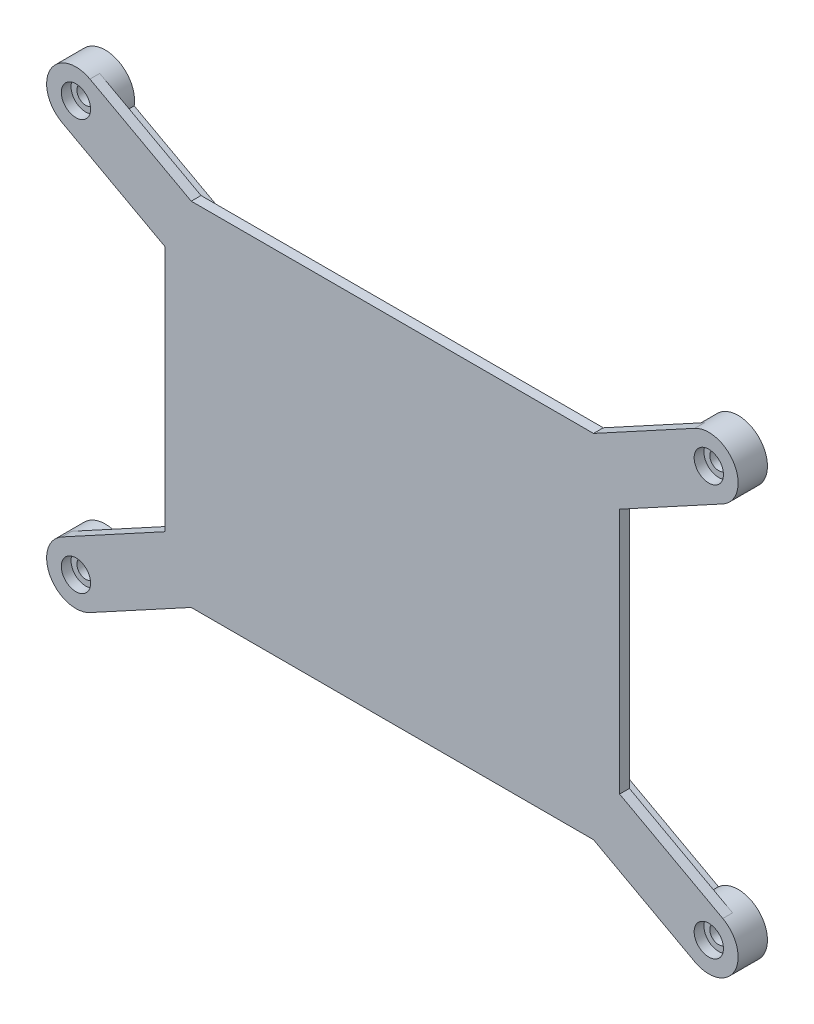
from build123d import *
from build123d.topology import SkipClean

# Parameters (mm, degrees)
BOSS_EXTRUDE4_DEPTH            = 4
BOSS_EXTRUDE4_2_DEPTH          = 4
BOSS_EXTRUDE7_START            = 4
SKETCH13_W                     = 77
SKETCH13_H                     = 2
BOSS_EXTRUDE7_DEPTH            = 2
CUT_EXTRUDE3_REACH             = 87.589
SKETCH11_W                     = 2
SKETCH11_H                     = 2.2
CUT_EXTRUDE3_DIRECTION_2_REACH = 87.589
BOSS_EXTRUDE6_DEPTH            = 2
M3_CLEARANCE_HOLE1_D           = 3.6
SKETCH16_R                     = 3
CUT_EXTRUDE4_DEPTH             = 2
CHAMFER2_SIZE                  = 2
CHAMFER3_SIZE                  = 0.5


with BuildPart() as part:
    # Sketch9 → Boss-Extrude4 (new body)
    with BuildSketch(Plane.XY):
        with BuildLine():
            Line((-60.736133913, -37.540305051), (-42.5, -27.622167018))
            Line((-42.5, -27.622167018), (-42.5, 27.622167018))
            Line((-42.5, 27.622167018), (-60.736133913, 37.540305051))
            ThreePointArc((-60.736133913, 37.540305051), (-70.020874221, 44.866685358), (-58.825010341, 41.054221199))
            Line((-58.825010341, 41.054221199), (-38.5, 30))
            Line((-38.5, 30), (-38.5, -30))
            Line((-38.5, -30), (-58.825010341, -41.054221199))
            ThreePointArc((-58.825010341, -41.054221199), (-70.020874221, -44.866685358), (-60.736133913, -37.540305051))
        make_face()
    extrude(amount=BOSS_EXTRUDE4_DEPTH)



with BuildPart() as body_2:
    # Sketch9 → Boss-Extrude4 2 (new body)
    with BuildSketch(Plane.XY):
        with BuildLine():
            Line((38.5, -30), (58.825010341, -41.054221199))
            ThreePointArc((58.825010341, -41.054221199), (70.020874221, -44.866685358), (60.736133913, -37.540305051))
            Line((60.736133913, -37.540305051), (42.5, -27.622167018))
            Line((42.5, -27.622167018), (42.5, 27.622167018))
            Line((42.5, 27.622167018), (60.736133913, 37.540305051))
            ThreePointArc((60.736133913, 37.540305051), (70.020874221, 44.866685358), (58.825010341, 41.054221199))
            Line((58.825010341, 41.054221199), (38.5, 30))
            Line((38.5, 30), (38.5, -30))
        make_face()
    extrude(amount=BOSS_EXTRUDE4_2_DEPTH)


with BuildPart() as part_1:
    add(part.part)

    add(body_2.part)  # Boss-Extrude7 merges body 2
    # Sketch13 → Boss-Extrude7 (add)
    with BuildSketch(Plane.XY.offset(BOSS_EXTRUDE7_START)):
        with Locations((0, -29)):
            Rectangle(SKETCH13_W, SKETCH13_H)
    extrude(amount=-BOSS_EXTRUDE7_DEPTH)

    # Cut-Extrude3: up to this face of the body (flat: up to its plane)
    cut_extrude3_end = Plane(part_1.part.faces().sort_by_distance((0, -28, 3))[0])
    # Sketch11 → Cut-Extrude3 (cut, up to the picked face)
    with BuildSketch(Plane(origin=(0, 0, 0), x_dir=(1, 0, 0), z_dir=(0, 1, 0)), mode=Mode.PRIVATE) as cut_extrude3_sk1:
        with Locations((-39.5, -2.9)):
            Rectangle(SKETCH11_W, SKETCH11_H)
    cut_extrude3_tool1 = split(extrude(cut_extrude3_sk1.sketch, amount=-CUT_EXTRUDE3_REACH, mode=Mode.PRIVATE), bisect_by=cut_extrude3_end, keep=Keep.BOTH, mode=Mode.PRIVATE)
    # Sketch11 → Cut-Extrude3 (cut, up to the picked face)
    with BuildSketch(Plane(origin=(0, 0, 0), x_dir=(1, 0, 0), z_dir=(0, 1, 0)), mode=Mode.PRIVATE) as cut_extrude3_sk2:
        with Locations((39.5, -2.9)):
            Rectangle(SKETCH11_W, SKETCH11_H)
    cut_extrude3_tool2 = split(extrude(cut_extrude3_sk2.sketch, amount=-CUT_EXTRUDE3_REACH, mode=Mode.PRIVATE), bisect_by=cut_extrude3_end, keep=Keep.BOTH, mode=Mode.PRIVATE)
    add(cut_extrude3_tool1.solids().sort_by(Axis((-39.5, 0, 2.9), (0, -1, 0)))[0], mode=Mode.SUBTRACT)
    add(cut_extrude3_tool2.solids().sort_by(Axis((39.5, 0, 2.9), (0, -1, 0)))[0], mode=Mode.SUBTRACT)

    # Sketch11 → Cut-Extrude3 direction 2 (cut, up to next)
    with BuildSketch(Plane(origin=(0, 0, 0), x_dir=(1, 0, 0), z_dir=(0, 1, 0)), mode=Mode.PRIVATE) as cut_extrude3_direction_2_sk1:
        with Locations((-39.5, -2.9)):
            Rectangle(SKETCH11_W, SKETCH11_H)
    cut_extrude3_direction_2_tool1 = extrude(cut_extrude3_direction_2_sk1.sketch, amount=CUT_EXTRUDE3_DIRECTION_2_REACH, mode=Mode.PRIVATE) & part_1.part
    # Sketch11 → Cut-Extrude3 direction 2 (cut, up to next)
    with BuildSketch(Plane(origin=(0, 0, 0), x_dir=(1, 0, 0), z_dir=(0, 1, 0)), mode=Mode.PRIVATE) as cut_extrude3_direction_2_sk2:
        with Locations((39.5, -2.9)):
            Rectangle(SKETCH11_W, SKETCH11_H)
    cut_extrude3_direction_2_tool2 = extrude(cut_extrude3_direction_2_sk2.sketch, amount=CUT_EXTRUDE3_DIRECTION_2_REACH, mode=Mode.PRIVATE) & part_1.part
    add(cut_extrude3_direction_2_tool1.solids().sort_by_distance((-39.5, 0, 2.9))[0], mode=Mode.SUBTRACT)
    add(cut_extrude3_direction_2_tool2.solids().sort_by_distance((39.5, 0, 2.9))[0], mode=Mode.SUBTRACT)

    # Sketch12 → Boss-Extrude6 (add)
    with SkipClean():  # the faces are left unmerged after this step: merging them gives an invalid solid
        with BuildSketch(Plane.XY.offset(4)):
            with BuildLine():
                Line((-67.616685358, 36.729125779), (-46.5, 25.244334036))
                Line((-46.5, 25.244334036), (-46.5, -25.244334036))
                Line((-46.5, -25.244334036), (-67.616685358, -36.729125779))
                ThreePointArc((-67.616685358, -36.729125779), (-70.020874221, -44.866685358), (-61.883314642, -47.270874221))
                Line((-61.883314642, -47.270874221), (-41.159951957, -36))
                Line((-41.159951957, -36), (41.159951957, -36))
                Line((41.159951957, -36), (61.883314642, -47.270874221))
                ThreePointArc((61.883314642, -47.270874221), (70.020874221, -44.866685358), (67.616685358, -36.729125779))
                Line((67.616685358, -36.729125779), (46.5, -25.244334036))
                Line((46.5, -25.244334036), (46.5, 25.244334036))
                Line((46.5, 25.244334036), (67.616685358, 36.729125779))
                ThreePointArc((67.616685358, 36.729125779), (70.020874221, 44.866685358), (61.883314642, 47.270874221))
                Line((61.883314642, 47.270874221), (41.159951957, 36))
                Line((41.159951957, 36), (-41.159951957, 36))
                Line((-41.159951957, 36), (-61.883314642, 47.270874221))
                ThreePointArc((-61.883314642, 47.270874221), (-70.020874221, 44.866685358), (-67.616685358, 36.729125779))
            make_face()
        extrude(amount=BOSS_EXTRUDE6_DEPTH)

    # M3 Clearance Hole1 (through all)
    with Locations(Plane(origin=(0, 0, 0), x_dir=(-1, 0, 0), z_dir=(0, 0, -1))):
        with Locations((64.75, 42), (64.75, -42), (-64.75, -42), (-64.75, 42)):
            Hole(M3_CLEARANCE_HOLE1_D / 2)

    # Sketch16 → Cut-Extrude4 (cut)
    with SkipClean():  # the faces are left unmerged after this step: merging them gives an invalid solid
        with BuildSketch(Plane.XY.offset(6)):
            with Locations((-64.75, 42)):
                Circle(SKETCH16_R)
            with Locations((-64.75, -42)):
                Circle(SKETCH16_R)
            with Locations((64.75, -42)):
                Circle(SKETCH16_R)
            with Locations((64.75, 42)):
                Circle(SKETCH16_R)
        extrude(amount=-CUT_EXTRUDE4_DEPTH, mode=Mode.SUBTRACT)

    # Chamfer2
    chamfer2_edges = [part_1.edges().sort_by_distance(p)[0] for p in [
        (-49.662505171, 36.070983444, 4),
        (49.662505171, 36.070983444, 4),
        (51.618066957, 32.581236035, 4),
        (42.5, 0, 4),
        (51.618066957, -32.581236035, 4),
        (48.662505171, -35.527110599, 4),
        (-48.662505171, -35.527110599, 4),
        (-51.618066957, -32.581236035, 4),
        (-51.618066957, 32.581236035, 4),
        (-42.5, 0, 4),
        (0, -30, 4),
    ]]
    chamfer(chamfer2_edges, length=CHAMFER2_SIZE - 0.0001)  # a hair under: the kernel refuses the full size

    # Chamfer3
    chamfer3_edges = [part_1.edges().sort_by_distance(p)[0] for p in [
        (-38.5, 0, 0),
        (38.5, 0, 0),
    ]]
    chamfer(chamfer3_edges, length=CHAMFER3_SIZE)


solid = part_1.part
